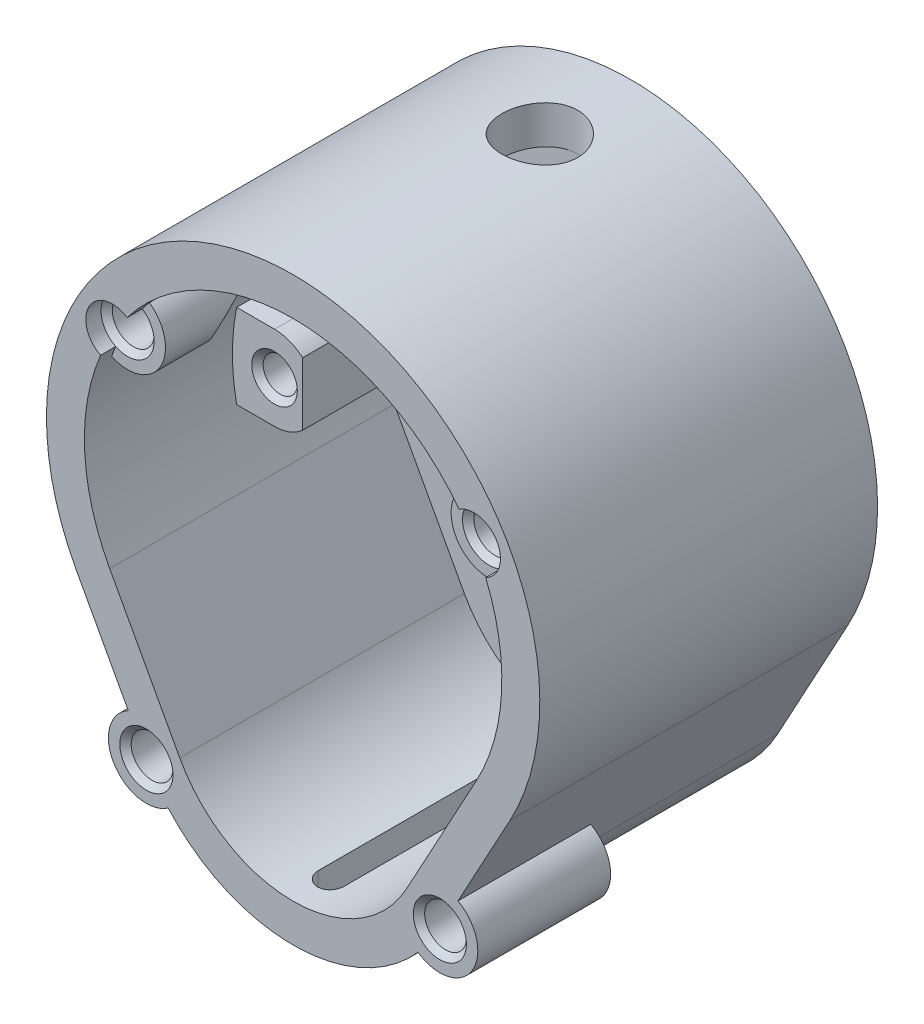
from build123d import *

# Parameters (mm, degrees)
BOSS_EXTRUDE1_DEPTH = 7
SKETCH2_R           = 2.75
CUT_EXTRUDE1_DEPTH  = 56.14752941
SKETCH3_R           = 7.1
CUT_EXTRUDE2_DEPTH  = 5
BOSS_EXTRUDE2_DEPTH = 37.5
SKETCH5_R           = 2.25
BOSS_EXTRUDE3_DEPTH = 18
CUT_EXTRUDE3_REACH  = 68.321
SKETCH6_R           = 1.7
SKETCH7_R           = 5
BOSS_EXTRUDE4_DEPTH = 17.5
CUT_REVOLVE2_ANGLE  = 145
CUT_EXTRUDE4_START  = -2
CUT_EXTRUDE4_DEPTH  = 2
SKETCH11_R          = 2.75
CUT_EXTRUDE6_DEPTH  = 12
CUT_EXTRUDE7_REACH  = 72.516
SKETCH12_R          = 1.5
CHAMFER1_SIZE       = 2
SKETCH13_W          = 36.5
SKETCH13_H          = 8.273451516
CUT_EXTRUDE9_DEPTH  = 18
CHAMFER2_SIZE       = 0.75
SKETCH14_R          = 3.5
CUT_EXTRUDE10_DEPTH = 2
CHAMFER3_SIZE       = 0.75
CUT_EXTRUDE11_DEPTH = 71.515955641
SKETCH16_R          = 5
CUT_EXTRUDE12_DEPTH = 71.515955785


with BuildPart() as part:
    # Sketch1 → Boss-Extrude1 (new body)
    with BuildSketch(Plane.XY):
        with BuildLine():
            Line((-28.559544782, -15.511363636), (-19.332614929, -32.5))
            ThreePointArc((-19.332614929, -32.5), (0, -44), (19.332614929, -32.5))
            Line((19.332614929, -32.5), (28.559544782, -15.511363636))
            ThreePointArc((28.559544782, -15.511363636), (0, 32.5), (-28.559544782, -15.511363636))
        make_face()
    extrude(amount=BOSS_EXTRUDE1_DEPTH)

    # Sketch2 → Cut-Extrude1 (cut, through all)
    with BuildSketch(Plane.XY.offset(7)):
        with Locations((0, -22)):
            Circle(SKETCH2_R)
    extrude(amount=-CUT_EXTRUDE1_DEPTH, mode=Mode.SUBTRACT)

    # Sketch3 → Cut-Extrude2 (cut)
    with BuildSketch(Plane.XY.offset(7)):
        with Locations((0, -22)):
            Circle(SKETCH3_R)
    extrude(amount=-CUT_EXTRUDE2_DEPTH, mode=Mode.SUBTRACT)

    # Sketch4 → Boss-Extrude2 (add)
    with BuildSketch(Plane.XY.offset(7)):
        with BuildLine():
            Line((-28.559544782, -15.511363636), (-19.332614929, -32.5))
            ThreePointArc((-19.332614929, -32.5), (0, -44), (19.332614929, -32.5))
            Line((19.332614929, -32.5), (28.559544782, -15.511363636))
            ThreePointArc((28.559544782, -15.511363636), (0, 32.5), (-28.559544782, -15.511363636))
        make_face()
        with BuildLine():
            Line((-24.165768661, -13.125), (-14.938838809, -30.113636364))
            ThreePointArc((-14.938838809, -30.113636364), (0, -39), (14.938838809, -30.113636364))
            Line((14.938838809, -30.113636364), (24.165768661, -13.125))
            ThreePointArc((24.165768661, -13.125), (0, 27.5), (-24.165768661, -13.125))
        make_face(mode=Mode.SUBTRACT)
    extrude(amount=BOSS_EXTRUDE2_DEPTH)

    # Sketch5 → Boss-Extrude3 (add)
    # profile 1 of 2: a face of its own
    with BuildSketch(Plane.XY.offset(7)):
        with BuildLine():
            Line((-21.95, 5.55), (-26.93413262, 5.55))
            ThreePointArc((-26.93413262, 5.55), (-27.5, 0), (-26.93413262, -5.55))
            Line((-26.93413262, -5.55), (-21.95, -5.55))
            ThreePointArc((-21.95, -5.55), (-16.4, 0), (-21.95, 5.55))
        make_face()
        with Locations((-21.95, 0)):
            Circle(SKETCH5_R, mode=Mode.SUBTRACT)
    # profile 2 of 2: a face of its own
    with BuildSketch(Plane.XY.offset(7)):
        with BuildLine():
            Line((21.95, 5.55), (26.93413262, 5.55))
            ThreePointArc((26.93413262, 5.55), (27.5, 0), (26.93413262, -5.55))
            Line((26.93413262, -5.55), (21.95, -5.55))
            ThreePointArc((21.95, -5.55), (16.4, 0), (21.95, 5.55))
        make_face()
        with Locations((21.95, 0)):
            Circle(SKETCH5_R, mode=Mode.SUBTRACT)
    extrude(amount=BOSS_EXTRUDE3_DEPTH)

    # Sketch6 → Cut-Extrude3 (cut, up to next)
    with BuildSketch(Plane.XY.offset(7), mode=Mode.PRIVATE) as cut_extrude3_sk1:
        with Locations((-12, 15.95)):
            Circle(SKETCH6_R)
    cut_extrude3_tool1 = extrude(cut_extrude3_sk1.sketch, amount=-CUT_EXTRUDE3_REACH, mode=Mode.PRIVATE) & part.part
    # Sketch6 → Cut-Extrude3 (cut, up to next)
    with BuildSketch(Plane.XY.offset(7), mode=Mode.PRIVATE) as cut_extrude3_sk2:
        with Locations((12, 15.95)):
            Circle(SKETCH6_R)
    cut_extrude3_tool2 = extrude(cut_extrude3_sk2.sketch, amount=-CUT_EXTRUDE3_REACH, mode=Mode.PRIVATE) & part.part
    # Sketch6 → Cut-Extrude3 (cut, up to next)
    with BuildSketch(Plane.XY.offset(7), mode=Mode.PRIVATE) as cut_extrude3_sk3:
        with Locations((-12, -1.05)):
            Circle(SKETCH6_R)
    cut_extrude3_tool3 = extrude(cut_extrude3_sk3.sketch, amount=-CUT_EXTRUDE3_REACH, mode=Mode.PRIVATE) & part.part
    # Sketch6 → Cut-Extrude3 (cut, up to next)
    with BuildSketch(Plane.XY.offset(7), mode=Mode.PRIVATE) as cut_extrude3_sk4:
        with Locations((12, -1.05)):
            Circle(SKETCH6_R)
    cut_extrude3_tool4 = extrude(cut_extrude3_sk4.sketch, amount=-CUT_EXTRUDE3_REACH, mode=Mode.PRIVATE) & part.part
    add(cut_extrude3_tool1.solids().sort_by_distance((-12, 15.95, 7))[0], mode=Mode.SUBTRACT)
    add(cut_extrude3_tool2.solids().sort_by_distance((12, 15.95, 7))[0], mode=Mode.SUBTRACT)
    add(cut_extrude3_tool3.solids().sort_by_distance((-12, -1.05, 7))[0], mode=Mode.SUBTRACT)
    add(cut_extrude3_tool4.solids().sort_by_distance((12, -1.05, 7))[0], mode=Mode.SUBTRACT)

    # Sketch7 → Boss-Extrude4 (add)
    with BuildSketch(Plane.XY.offset(44.5)):
        with Locations((-23.815698604, 13.75)):
            Circle(SKETCH7_R)
        with Locations((23.815698604, 13.75)):
            Circle(SKETCH7_R)
        with Locations((-19.332614929, -32.5)):
            Circle(SKETCH7_R)
        with Locations((19.332614929, -32.5)):
            Circle(SKETCH7_R)
    extrude(amount=-BOSS_EXTRUDE4_DEPTH)

    # Sketch9 → Cut-Revolve2 (revolve, symmetric, cut)
    with BuildSketch(Plane(origin=(0, 0, 0), x_dir=(0, 0, -1), z_dir=(1, 0, 0))) as cut_revolve2_sk:
        Polygon((-27, 27.5), (-35.660254038, 22.5), (-27, 22.5), align=None)
    revolve(axis=Axis((0, 0, 0), (0, 0, 1)), revolution_arc=CUT_REVOLVE2_ANGLE / 2, mode=Mode.SUBTRACT)
    revolve(cut_revolve2_sk.sketch, axis=Axis((0, 0, 0), (0, 0, -1)), revolution_arc=CUT_REVOLVE2_ANGLE / 2, mode=Mode.SUBTRACT)

    # Sketch10 → Cut-Extrude4 (cut)
    with BuildSketch(Plane.XY.offset(44.5).offset(CUT_EXTRUDE4_START)):
        with BuildLine():
            Line((-24.165768661, -13.125), (-14.938838809, -30.113636364))
            ThreePointArc((-14.938838809, -30.113636364), (0, -39), (14.938838809, -30.113636364))
            Line((14.938838809, -30.113636364), (24.165768661, -13.125))
            ThreePointArc((24.165768661, -13.125), (0, 27.5), (-24.165768661, -13.125))
        make_face()
    extrude(amount=CUT_EXTRUDE4_DEPTH, mode=Mode.SUBTRACT)

    # Sketch11 → Cut-Extrude6 (cut)
    with BuildSketch(Plane.XY.offset(44.5)):
        with Locations((-23.815698604, 13.75)):
            Circle(SKETCH11_R)
        with Locations((23.815698604, 13.75)):
            Circle(SKETCH11_R)
        with Locations((-19.332614929, -32.5)):
            Circle(SKETCH11_R)
        with Locations((19.332614929, -32.5)):
            Circle(SKETCH11_R)
    extrude(amount=-CUT_EXTRUDE6_DEPTH, mode=Mode.SUBTRACT)

    # Sketch12 → Cut-Extrude7 (cut, up to next)
    with BuildSketch(Plane(origin=(0, 0, 0), x_dir=(-1, 0, 0), z_dir=(0, 0, -1)), mode=Mode.PRIVATE) as cut_extrude7_sk1:
        with Locations((4.2, -33.55)):
            Circle(SKETCH12_R)
    cut_extrude7_tool1 = extrude(cut_extrude7_sk1.sketch, amount=-CUT_EXTRUDE7_REACH, mode=Mode.PRIVATE) & part.part
    # Sketch12 → Cut-Extrude7 (cut, up to next)
    with BuildSketch(Plane(origin=(0, 0, 0), x_dir=(-1, 0, 0), z_dir=(0, 0, -1)), mode=Mode.PRIVATE) as cut_extrude7_sk2:
        with Locations((-5.3, -33.55)):
            Circle(SKETCH12_R)
    cut_extrude7_tool2 = extrude(cut_extrude7_sk2.sketch, amount=-CUT_EXTRUDE7_REACH, mode=Mode.PRIVATE) & part.part
    add(cut_extrude7_tool1.solids().sort_by_distance((-4.2, -33.55, 0))[0], mode=Mode.SUBTRACT)
    add(cut_extrude7_tool2.solids().sort_by_distance((5.3, -33.55, 0))[0], mode=Mode.SUBTRACT)

    # Chamfer1
    chamfer1_edges = [part.edges().sort_by_distance(p)[0] for p in [
        (10.3, -1.05, 7),
        (-13.7, -1.05, 7),
        (-13.7, 15.95, 7),
        (10.3, 15.95, 7),
    ]]
    chamfer(chamfer1_edges, length=CHAMFER1_SIZE)

    # Sketch13 → Cut-Extrude9 (cut)
    with BuildSketch(Plane.XY.offset(25)):
        Rectangle(SKETCH13_W, SKETCH13_H)
    extrude(amount=-CUT_EXTRUDE9_DEPTH, mode=Mode.SUBTRACT)

    # Chamfer2
    chamfer2_edges = [part.edges().sort_by_distance(p)[0] for p in [
        (-22.082614929, -32.5, 44.5),
        (16.582614929, -32.5, 44.5),
        (-2.7, -33.55, 0),
        (6.8, -33.55, 0),
        (-24.2, 0, 25),
        (19.7, 0, 25),
    ]]
    chamfer(chamfer2_edges, length=CHAMFER2_SIZE)

    # Sketch14 → Cut-Extrude10 (cut)
    with BuildSketch(Plane.XY.offset(44.5)):
        with Locations((-23.815698604, 13.75)):
            Circle(SKETCH14_R)
        with Locations((23.815698604, 13.75)):
            Circle(SKETCH14_R)
    extrude(amount=-CUT_EXTRUDE10_DEPTH, mode=Mode.SUBTRACT)

    # Chamfer3
    chamfer3_edges = [part.edges().sort_by_distance(p)[0] for p in [
        (21.065698604, 13.75, 42.5),
        (-26.565698604, 13.75, 42.5),
    ]]
    chamfer(chamfer3_edges, length=CHAMFER3_SIZE - 0.0001)  # a hair under: the kernel refuses the full size

    # Sketch15 → Cut-Extrude11 (cut, through all)
    with BuildSketch(Plane(origin=(0, 0, 0), x_dir=(1, 0, 0), z_dir=(0, 1, 0))):
        with BuildLine():
            Line((1.75, -10), (1.75, -39.5))
            ThreePointArc((1.75, -39.5), (0, -41.25), (-1.75, -39.5))
            Line((-1.75, -39.5), (-1.75, -10))
            ThreePointArc((-1.75, -10), (0, -8.25), (1.75, -10))
        make_face()
    extrude(amount=-CUT_EXTRUDE11_DEPTH, mode=Mode.SUBTRACT)

    # Sketch16 → Cut-Extrude12 (cut, through all)
    with BuildSketch(Plane(origin=(0, 0, 0), x_dir=(1, 0, 0), z_dir=(0, 1, 0))):
        with Locations(Location((0, -12, 0), (0, 0, 90))):
            Circle(SKETCH16_R)
    extrude(amount=CUT_EXTRUDE12_DEPTH, mode=Mode.SUBTRACT)


solid = part.part
